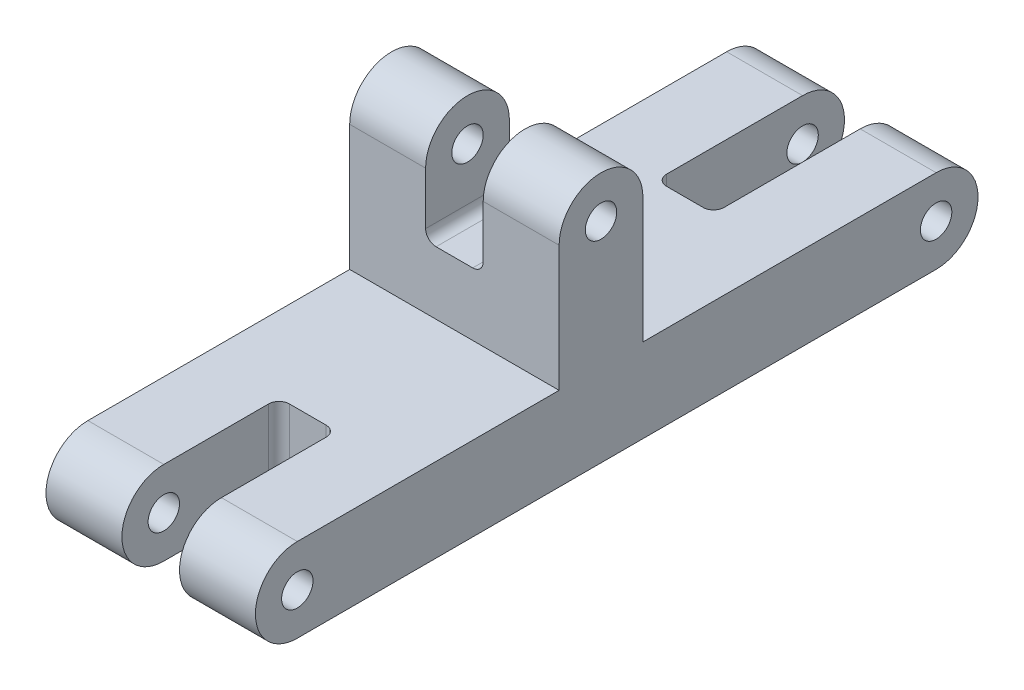
from build123d import *

# Parameters (mm, degrees)
CROQUIS1_R              = 1.5
SALIENTE_EXTRUIR1_DEPTH = 10
CROQUIS2_W              = 8
CROQUIS2_H              = 10
CROQUIS2_W_2            = 18
CROQUIS2_H_2            = 8
CROQUIS2_W_3            = 15
CORTAR_EXTRUIR1_DEPTH   = 2.75
REDONDEO1_R             = 1


with BuildPart() as part:
    # Croquis1 → Saliente-Extruir1 (new, symmetric)
    with BuildSketch(Plane(origin=(0, 0, 0), x_dir=(0, 0, -1), z_dir=(1, 0, 0))):
        with BuildLine():
            Line((-15, -4), (15, -4))
            ThreePointArc((15, -4), (19, 0), (15, 4))
            Line((15, 4), (-13, 4))
            Line((-13, 4), (-13, 16))
            ThreePointArc((-13, 16), (-17, 20), (-21, 16))
            Line((-21, 16), (-21, 4))
            Line((-21, 4), (-46, 4))
            ThreePointArc((-46, 4), (-50, 0), (-46, -4))
            Line((-46, -4), (-15, -4))
        make_face()
        with Locations((15, 0)):
            Circle(CROQUIS1_R, mode=Mode.SUBTRACT)
        with Locations((-17, 16)):
            Circle(CROQUIS1_R, mode=Mode.SUBTRACT)
        with Locations((-46, 0)):
            Circle(CROQUIS1_R, mode=Mode.SUBTRACT)
    extrude(amount=SALIENTE_EXTRUIR1_DEPTH, both=True)

    # Croquis2 → Cortar-Extruir1 (cut, symmetric)
    with BuildSketch(Plane(origin=(0, 0, 0), x_dir=(0, 0, -1), z_dir=(1, 0, 0))):
        with Locations((-17, 15)):
            Rectangle(CROQUIS2_W, CROQUIS2_H)
        with Locations((10, 0)):
            Rectangle(CROQUIS2_W_2, CROQUIS2_H_2)
        with Locations((-42.5, 0)):
            Rectangle(CROQUIS2_W_3, CROQUIS2_H_2)
    extrude(amount=CORTAR_EXTRUIR1_DEPTH, both=True, mode=Mode.SUBTRACT)

    # Redondeo1
    redondeo1_edges = [part.edges().sort_by_distance(p)[0] for p in [
        (2.75, 0, 35),
        (-2.75, 0, 35),
        (2.75, 0, -1),
        (-2.75, 0, -1),
        (2.75, 10, 17),
        (-2.75, 10, 17),
    ]]
    fillet(redondeo1_edges, radius=REDONDEO1_R)


solid = part.part
